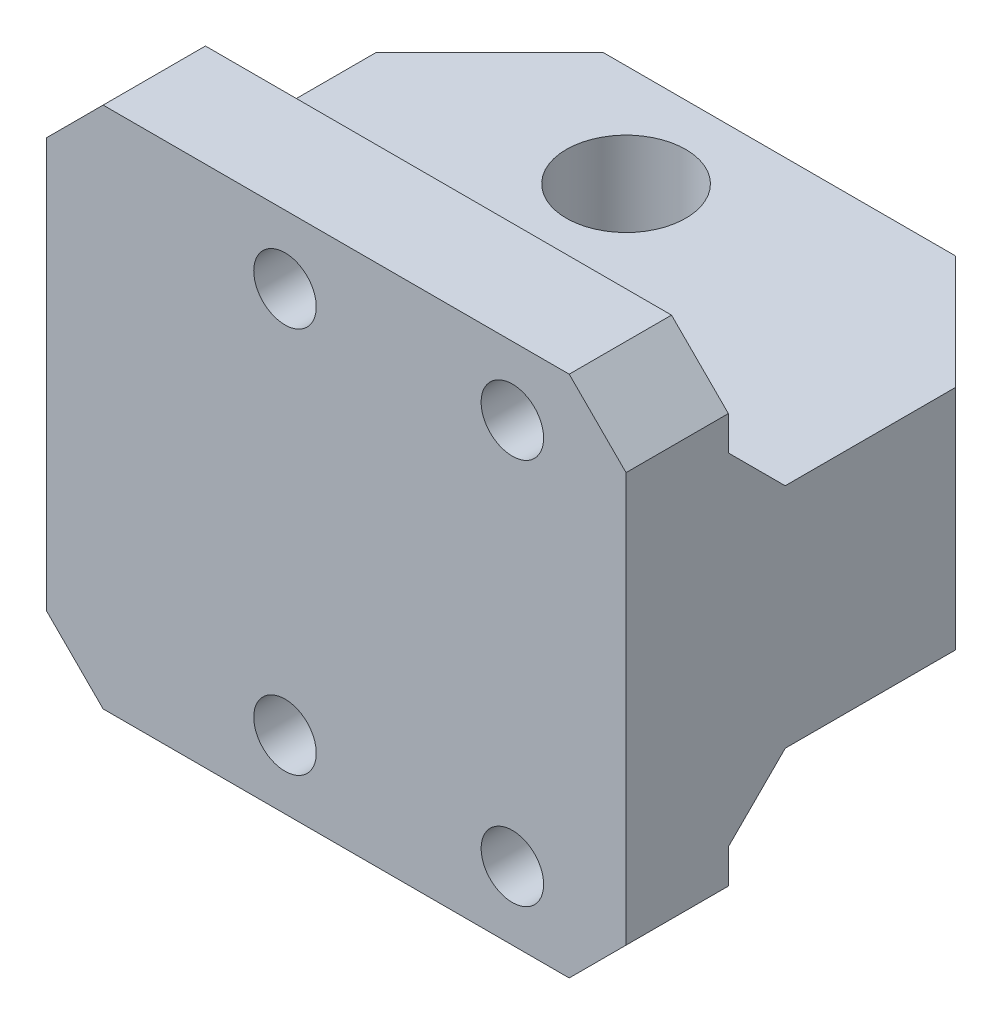
from build123d import *

# Parameters (mm, degrees)
SKETCH_1_R          = 2.75
EXTRUDE_1_DEPTH     = 9
SKETCH_6_R          = 4.25
CUT_EXTRUDE_3_DEPTH = 5
CHAMFER_2_SIZE      = 5
SKETCH_8_W          = 51
SKETCH_8_H          = 20
EXTRUDE_2_DEPTH     = 30
SKETCH_9_R          = 5.25
CUT_EXTRUDE_4_DEPTH = 60.245252974
CHAMFER_3_SIZE      = 10
CHAMFER_4_SIZE      = 5
SKETCH_10_W         = 72.974519151
SKETCH_10_H         = 96.032014279
CUT_EXTRUDE_5_DEPTH = 55.313902456


# Read off the part's stored shape, not the designer's step: 鏡射1
with BuildPart() as part:
    # 草圖1 → 填料-伸長1 (new body)
    with BuildSketch(Plane.XY):
        Polygon((30, 23), (21, 23), (-21, 23), (-21, -23), (21, -23), (30, -23), align=None)
        with Locations((0, 17)):
            Circle(SKETCH_1_R, mode=Mode.SUBTRACT)
        with Locations((20, 17)):
            Circle(SKETCH_1_R, mode=Mode.SUBTRACT)
        with Locations((20, -17)):
            Circle(SKETCH_1_R, mode=Mode.SUBTRACT)
        with Locations((0, -17)):
            Circle(SKETCH_1_R, mode=Mode.SUBTRACT)
    extrude(amount=EXTRUDE_1_DEPTH)

    # 草圖6 → 除料-伸長3 (cut)
    with BuildSketch(Plane.XY.offset(9)):
        with Locations((0, 17)):
            Circle(SKETCH_6_R)
        with Locations((20, 17)):
            Circle(SKETCH_6_R)
        with Locations((20, -17)):
            Circle(SKETCH_6_R)
        with Locations((0, -17)):
            Circle(SKETCH_6_R)
    extrude(amount=-CUT_EXTRUDE_3_DEPTH, mode=Mode.SUBTRACT)

    # 導角2
    chamfer_2_edges = [part.edges().sort_by_distance(p)[0] for p in [
        (-21, 23, 4.5),
        (30, 23, 4.5),
        (30, -23, 4.5),
        (-21, -23, 4.5),
    ]]
    chamfer(chamfer_2_edges, length=CHAMFER_2_SIZE)

    # 草圖8 → 填料-伸長2 (add)
    with BuildSketch(Plane.XY.offset(9)):
        with Locations((4.5, 0)):
            Rectangle(SKETCH_8_W, SKETCH_8_H)
    extrude(amount=EXTRUDE_2_DEPTH)

    # 草圖9 → 除料-伸長4 (cut, through all)
    with BuildSketch(Plane(origin=(0, 10, 0), x_dir=(1, 0, 0), z_dir=(0, 1, 0))):
        with Locations(Location((0, -30, 0), (0, 0, 180))):
            Circle(SKETCH_9_R)
    extrude(amount=-CUT_EXTRUDE_4_DEPTH, mode=Mode.SUBTRACT)

    # 導角3
    chamfer_3_edges = [part.edges().sort_by_distance(p)[0] for p in [
        (-21, 0, 39),
        (30, 0, 39),
    ]]
    chamfer(chamfer_3_edges, length=CHAMFER_3_SIZE)

    # 導角4
    # the kernel refuses this chamfer: 5 mm, written as the material it adds along each edge
    with BuildSketch(Plane(origin=(-21, -10, 9), x_dir=(0, 0.027495876610586317, 0.9996219169112968), z_dir=(1, 0, 0))) as chamfer_4_piece_1_section:
        Polygon((CHAMFER_4_SIZE * 0.999621916911, CHAMFER_4_SIZE * 0.0274958766106), (-CHAMFER_4_SIZE * 0.0274958766106, CHAMFER_4_SIZE * 0.999621916911), (0, 0), align=None)
    chamfer_4_piece_1 = extrude(amount=51, mode=Mode.PRIVATE)
    chamfer_4_piece_1 = chamfer_4_piece_1 - Plane(origin=(0, -17, 10.693214972), x_dir=(1, 0, 0), z_dir=(0, 0, 1)) * Cylinder(4.25, 122, mode=Mode.PRIVATE)
    chamfer_4_piece_1 = chamfer_4_piece_1 - Plane(origin=(20, -17, 10.693214972), x_dir=(1, 0, 0), z_dir=(0, 0, 1)) * Cylinder(4.25, 122, mode=Mode.PRIVATE)
    add(chamfer_4_piece_1)
    with BuildSketch(Plane(origin=(30, 10, 9), x_dir=(0, -0.027495876610586317, 0.9996219169112968), z_dir=(-1, 0, 0))) as chamfer_4_piece_2_section:
        Polygon((CHAMFER_4_SIZE * 0.999621916911, CHAMFER_4_SIZE * 0.0274958766106), (-CHAMFER_4_SIZE * 0.0274958766106, CHAMFER_4_SIZE * 0.999621916911), (0, 0), align=None)
    chamfer_4_piece_2 = extrude(amount=51, mode=Mode.PRIVATE)
    chamfer_4_piece_2 = chamfer_4_piece_2 - Plane(origin=(0, 17, 10.693214972), x_dir=(1, 0, 0), z_dir=(0, 0, 1)) * Cylinder(4.25, 122, mode=Mode.PRIVATE)
    chamfer_4_piece_2 = chamfer_4_piece_2 - Plane(origin=(20, 17, 10.693214972), x_dir=(1, 0, 0), z_dir=(0, 0, 1)) * Cylinder(4.25, 122, mode=Mode.PRIVATE)
    add(chamfer_4_piece_2)

    # 鏡射1: part across plane


with BuildPart() as part_1:
    add(part.part)
    add(part.part.mirror(Plane.XY))

    # 草圖10 → 除料-伸長5 (cut, through all)
    with BuildSketch(Plane.XY):
        with Locations((8.056741269, 11.95800944)):
            Rectangle(SKETCH_10_W, SKETCH_10_H)
    extrude(amount=CUT_EXTRUDE_5_DEPTH, mode=Mode.SUBTRACT)


solid = part_1.part
